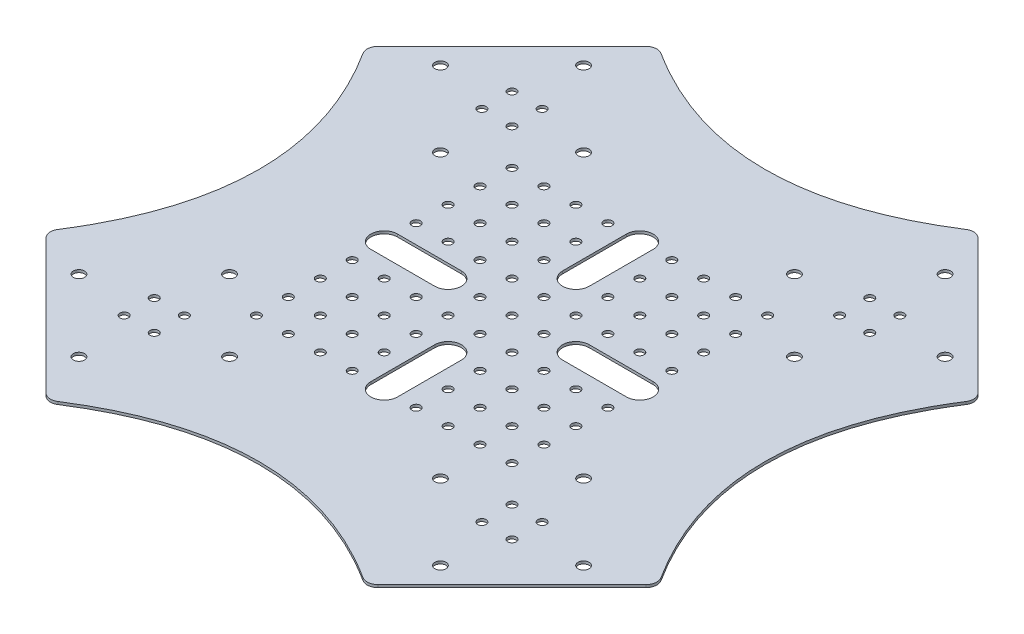
from build123d import *

# Parameters (mm, degrees)
DODANIE_WYCI_GNI_CIE1_DEPTH = 1
ZAOKR_GLENIE1_R             = 4
SZKIC2_R                    = 2.1
WYTNIJ_WYCI_GNI_CIE1_DEPTH  = 162.050129512
SZYK_KO_OWY1_COUNT          = 4
SZKIC3_R                    = 1.6
WYTNIJ_WYCI_GNI_CIE2_DEPTH  = 162.050129512
SZYK_KO_OWY2_OUTLINE_R      = 1.6
SZYK_KO_OWY2_DEPTH          = 1
WYTNIJ_WYCI_GNI_CIE3_REACH  = 163.05
SZKIC4_R                    = 1.6
SZYK_LINIOWY1_COUNT         = 5
SZYK_LINIOWY1_PITCH         = 12
SZYK_LINIOWY1_COUNT_DIR2    = 5
SZYK_LINIOWY1_PITCH_DIR2    = 12
SZYK_KO_OWY3_OUTLINE_R      = 1.6
SZYK_KO_OWY3_DEPTH          = 1
WYTNIJ_WYCI_GNI_CIE4_DEPTH  = 162.050129512


# Read off the part's stored shape, not the designer's step: Szyk kołowy2, Szyk kołowy3
with BuildPart() as part:
    # Szkic1 → Dodanie-wyciągnięcie1 (new body)
    with BuildSketch(Plane(origin=(0, 0, 0), x_dir=(1, 0, 0), z_dir=(0, 1, 0))):
        with BuildLine():
            Line((-60, -115), (-115, -60))
            add(Edge.make_bspline(
                [(-115, 60), (-75, 0), (-115, -60)],
                knots=[0, 0, 0, 1, 1, 1], degree=2))
            Line((-115, 60), (-60, 115))
            add(Edge.make_bspline(
                [(60, 115), (0, 75), (-60, 115)],
                knots=[0, 0, 0, 1, 1, 1], degree=2))
            Line((60, 115), (115, 60))
            add(Edge.make_bspline(
                [(115, -60), (75, 0), (115, 60)],
                knots=[0, 0, 0, 1, 1, 1], degree=2))
            Line((115, -60), (60, -115))
            add(Edge.make_bspline(
                [(-60, -115), (0, -75), (60, -115)],
                knots=[0, 0, 0, 1, 1, 1], degree=2))
        make_face()
    extrude(amount=DODANIE_WYCI_GNI_CIE1_DEPTH)

    # Zaokrąglenie1
    zaokr_glenie1_edges = [part.edges().sort_by_distance(p)[0] for p in [
        (-115, 0.5, -60),
        (-60, 0.5, -115),
        (60, 0.5, -115),
        (115, 0.5, -60),
        (115, 0.5, 60),
        (60, 0.5, 115),
        (-115, 0.5, 60),
        (-60, 0.5, 115),
    ]]
    fillet(zaokr_glenie1_edges, radius=ZAOKR_GLENIE1_R)

    # Szkic2 → Wytnij-wyciągnięcie1 (cut, through all)
    with BuildSketch(Plane(origin=(0, 1, 0), x_dir=(1, 0, 0), z_dir=(0, 1, 0))):
        with Locations(Location((-67.882250994, -94.752308679, 0), (0, 0, 270))):
            Circle(SZKIC2_R)
        with Locations(Location((-94.752308679, -67.882250994, 0), (0, 0, 90))):
            Circle(SZKIC2_R)
        with Locations(Location((-39.597979746, -66.468037432, 0), (0, 0, 90))):
            Circle(SZKIC2_R)
        with Locations(Location((-66.468037432, -39.597979746, 0), (0, 0, 270))):
            Circle(SZKIC2_R)
    wytnij_wyci_gni_cie1 = extrude(amount=-WYTNIJ_WYCI_GNI_CIE1_DEPTH, mode=Mode.SUBTRACT)

    # Szyk kołowy1: Wytnij-wyciągnięcie1 ×4 about axis
    szyk_ko_owy1_axis = Axis((0, 0, 0), (0, 1, 0))
    for i in range(1, SZYK_KO_OWY1_COUNT):
        add(wytnij_wyci_gni_cie1.rotate(szyk_ko_owy1_axis, i * 360 / SZYK_KO_OWY1_COUNT), mode=Mode.SUBTRACT)

    # Szkic3 → Wytnij-wyciągnięcie2 (cut, through all)
    with BuildSketch(Plane(origin=(0, 1, 0), x_dir=(1, 0, 0), z_dir=(0, 1, 0))):
        with Locations(Location((-61.518289963, -61.518289963, 0), (0, 0, 270))):
            Circle(SZKIC3_R)
        with Locations(Location((-61.518289963, 61.518289963, 0), (0, 0, 270))):
            Circle(SZKIC3_R)
        with Locations(Location((61.518289963, 61.518289963, 0), (0, 0, 270))):
            Circle(SZKIC3_R)
        with Locations(Location((61.518289963, -61.518289963, 0), (0, 0, 270))):
            Circle(SZKIC3_R)
        with Locations(Location((-72.831998462, -72.831998462, 0), (0, 0, 270))):
            Circle(SZKIC3_R)
        with Locations(Location((-61.518289963, -72.831998462, 0), (0, 0, 270))):
            Circle(SZKIC3_R)
        with Locations(Location((-72.831998462, -61.518289963, 0), (0, 0, 270))):
            Circle(SZKIC3_R)
    wytnij_wyci_gni_cie2 = extrude(amount=-WYTNIJ_WYCI_GNI_CIE2_DEPTH, mode=Mode.SUBTRACT)

    # Lustro1: Wytnij-wyciągnięcie2 across plane
    add(wytnij_wyci_gni_cie2.mirror(Plane(origin=(0, 0, 0), x_dir=(0, 0, 1), z_dir=(1, 0, 0))), mode=Mode.SUBTRACT)

    # Szyk kołowy2 outline → Szyk kołowy2 (cut)
    with BuildSketch(Plane(origin=(0, 0, 0), x_dir=(1, 0, 0), z_dir=(0, 1, 0))):
        with Locations((-61.518289963, 72.831998462)):
            Circle(SZYK_KO_OWY2_OUTLINE_R)
        with Locations((-72.831998462, 72.831998462)):
            Circle(SZYK_KO_OWY2_OUTLINE_R)
        with Locations((-72.831998462, 61.518289963)):
            Circle(SZYK_KO_OWY2_OUTLINE_R)
        with Locations((61.518289963, 72.831998462)):
            Circle(SZYK_KO_OWY2_OUTLINE_R)
        with Locations((72.831998462, 72.831998462)):
            Circle(SZYK_KO_OWY2_OUTLINE_R)
        with Locations((72.831998462, 61.518289963)):
            Circle(SZYK_KO_OWY2_OUTLINE_R)
    extrude(amount=SZYK_KO_OWY2_DEPTH, mode=Mode.SUBTRACT)

    # Szkic4 → Wytnij-wyciągnięcie3 (cut, up to next)
    with BuildSketch(Plane(origin=(0, 1, 0), x_dir=(1, 0, 0), z_dir=(0, 1, 0)), mode=Mode.PRIVATE) as wytnij_wyci_gni_cie3_sk1:
        with Locations(Location((0, 0, 0), (0, 0, 270))):
            Circle(SZKIC4_R)
    wytnij_wyci_gni_cie3_tool1 = extrude(wytnij_wyci_gni_cie3_sk1.sketch, amount=-WYTNIJ_WYCI_GNI_CIE3_REACH, mode=Mode.PRIVATE) & part.part
    wytnij_wyci_gni_cie3 = wytnij_wyci_gni_cie3_tool1.solids().sort_by_distance((0, 1, 0))[0]
    add(wytnij_wyci_gni_cie3, mode=Mode.SUBTRACT)

    # Szyk liniowy1: Wytnij-wyci_gni_cie3 5 × 5
    with Locations(*[(j * SZYK_LINIOWY1_PITCH_DIR2, 0, i * SZYK_LINIOWY1_PITCH) for i in range(SZYK_LINIOWY1_COUNT) for j in range(SZYK_LINIOWY1_COUNT_DIR2) if (i, j) != (0, 0)]):
        add(wytnij_wyci_gni_cie3, mode=Mode.SUBTRACT)

    # Szyk kołowy3 outline → Szyk kołowy3 (cut)
    with BuildSketch(Plane(origin=(0, 0, 0), x_dir=(1, 0, 0), z_dir=(0, 1, 0))):
        with Locations((36, 48)):
            Circle(SZYK_KO_OWY3_OUTLINE_R)
        with Locations((36, 36)):
            Circle(SZYK_KO_OWY3_OUTLINE_R)
        with Locations((36, 24)):
            Circle(SZYK_KO_OWY3_OUTLINE_R)
        with Locations((48, 12)):
            Circle(SZYK_KO_OWY3_OUTLINE_R)
        with Locations((48, 24)):
            Circle(SZYK_KO_OWY3_OUTLINE_R)
        with Locations((48, 36)):
            Circle(SZYK_KO_OWY3_OUTLINE_R)
        with Locations((48, 48)):
            Circle(SZYK_KO_OWY3_OUTLINE_R)
        with Locations((0, 12)):
            Circle(SZYK_KO_OWY3_OUTLINE_R)
        with Locations((0, 24)):
            Circle(SZYK_KO_OWY3_OUTLINE_R)
        with Locations((0, 36)):
            Circle(SZYK_KO_OWY3_OUTLINE_R)
        with Locations((0, 48)):
            Circle(SZYK_KO_OWY3_OUTLINE_R)
        with Locations((12, 12)):
            Circle(SZYK_KO_OWY3_OUTLINE_R)
        with Locations((12, 24)):
            Circle(SZYK_KO_OWY3_OUTLINE_R)
        with Locations((12, 36)):
            Circle(SZYK_KO_OWY3_OUTLINE_R)
        with Locations((36, 12)):
            Circle(SZYK_KO_OWY3_OUTLINE_R)
        with Locations((24, 48)):
            Circle(SZYK_KO_OWY3_OUTLINE_R)
        with Locations((24, 36)):
            Circle(SZYK_KO_OWY3_OUTLINE_R)
        with Locations((12, 48)):
            Circle(SZYK_KO_OWY3_OUTLINE_R)
        with Locations((24, 12)):
            Circle(SZYK_KO_OWY3_OUTLINE_R)
        with Locations((24, 24)):
            Circle(SZYK_KO_OWY3_OUTLINE_R)
        with Locations((-48, 36)):
            Circle(SZYK_KO_OWY3_OUTLINE_R)
        with Locations((-36, 36)):
            Circle(SZYK_KO_OWY3_OUTLINE_R)
        with Locations((-24, 36)):
            Circle(SZYK_KO_OWY3_OUTLINE_R)
        with Locations((-12, 48)):
            Circle(SZYK_KO_OWY3_OUTLINE_R)
        with Locations((-24, 48)):
            Circle(SZYK_KO_OWY3_OUTLINE_R)
        with Locations((-36, 48)):
            Circle(SZYK_KO_OWY3_OUTLINE_R)
        with Locations((-48, 48)):
            Circle(SZYK_KO_OWY3_OUTLINE_R)
        with Locations((-12, 0)):
            Circle(SZYK_KO_OWY3_OUTLINE_R)
        with Locations((-24, 0)):
            Circle(SZYK_KO_OWY3_OUTLINE_R)
        with Locations((-36, 0)):
            Circle(SZYK_KO_OWY3_OUTLINE_R)
        with Locations((-48, 0)):
            Circle(SZYK_KO_OWY3_OUTLINE_R)
        with Locations((-12, 12)):
            Circle(SZYK_KO_OWY3_OUTLINE_R)
        with Locations((-24, 12)):
            Circle(SZYK_KO_OWY3_OUTLINE_R)
        with Locations((-36, 12)):
            Circle(SZYK_KO_OWY3_OUTLINE_R)
        with Locations((-12, 36)):
            Circle(SZYK_KO_OWY3_OUTLINE_R)
        with Locations((-48, 24)):
            Circle(SZYK_KO_OWY3_OUTLINE_R)
        with Locations((-36, 24)):
            Circle(SZYK_KO_OWY3_OUTLINE_R)
        with Locations((-48, 12)):
            Circle(SZYK_KO_OWY3_OUTLINE_R)
        with Locations((-12, 24)):
            Circle(SZYK_KO_OWY3_OUTLINE_R)
        with Locations((-24, 24)):
            Circle(SZYK_KO_OWY3_OUTLINE_R)
        with Locations((-36, -48)):
            Circle(SZYK_KO_OWY3_OUTLINE_R)
        with Locations((-36, -36)):
            Circle(SZYK_KO_OWY3_OUTLINE_R)
        with Locations((-36, -24)):
            Circle(SZYK_KO_OWY3_OUTLINE_R)
        with Locations((-48, -12)):
            Circle(SZYK_KO_OWY3_OUTLINE_R)
        with Locations((-48, -24)):
            Circle(SZYK_KO_OWY3_OUTLINE_R)
        with Locations((-48, -36)):
            Circle(SZYK_KO_OWY3_OUTLINE_R)
        with Locations((-48, -48)):
            Circle(SZYK_KO_OWY3_OUTLINE_R)
        with Locations((-12, -12)):
            Circle(SZYK_KO_OWY3_OUTLINE_R)
        with Locations((-12, -24)):
            Circle(SZYK_KO_OWY3_OUTLINE_R)
        with Locations((-12, -36)):
            Circle(SZYK_KO_OWY3_OUTLINE_R)
        with Locations((-36, -12)):
            Circle(SZYK_KO_OWY3_OUTLINE_R)
        with Locations((-24, -48)):
            Circle(SZYK_KO_OWY3_OUTLINE_R)
        with Locations((-24, -36)):
            Circle(SZYK_KO_OWY3_OUTLINE_R)
        with Locations((-12, -48)):
            Circle(SZYK_KO_OWY3_OUTLINE_R)
        with Locations((-24, -12)):
            Circle(SZYK_KO_OWY3_OUTLINE_R)
        with Locations((-24, -24)):
            Circle(SZYK_KO_OWY3_OUTLINE_R)
    extrude(amount=SZYK_KO_OWY3_DEPTH, mode=Mode.SUBTRACT)

    # Szkic5 → Wytnij-wyciągnięcie4 (cut, through all)
    with BuildSketch(Plane(origin=(0, 1, 0), x_dir=(1, 0, 0), z_dir=(0, 1, 0))):
        with BuildLine():
            Line((-48, 5), (-24, 5))
            ThreePointArc((-24, 5), (-19, 0), (-24, -5))
            Line((-24, -5), (-48, -5))
            ThreePointArc((-48, -5), (-53, 0), (-48, 5))
        make_face()
        with BuildLine():
            Line((5, 48), (5, 24))
            ThreePointArc((5, 24), (0, 19), (-5, 24))
            Line((-5, 24), (-5, 48))
            ThreePointArc((-5, 48), (0, 53), (5, 48))
        make_face()
        with BuildLine():
            Line((48, -5), (24, -5))
            ThreePointArc((24, -5), (19, 0), (24, 5))
            Line((24, 5), (48, 5))
            ThreePointArc((48, 5), (53, 0), (48, -5))
        make_face()
        with BuildLine():
            Line((-5, -48), (-5, -24))
            ThreePointArc((-5, -24), (0, -19), (5, -24))
            Line((5, -24), (5, -48))
            ThreePointArc((5, -48), (0, -53), (-5, -48))
        make_face()
    extrude(amount=-WYTNIJ_WYCI_GNI_CIE4_DEPTH, mode=Mode.SUBTRACT)


solid = part.part
